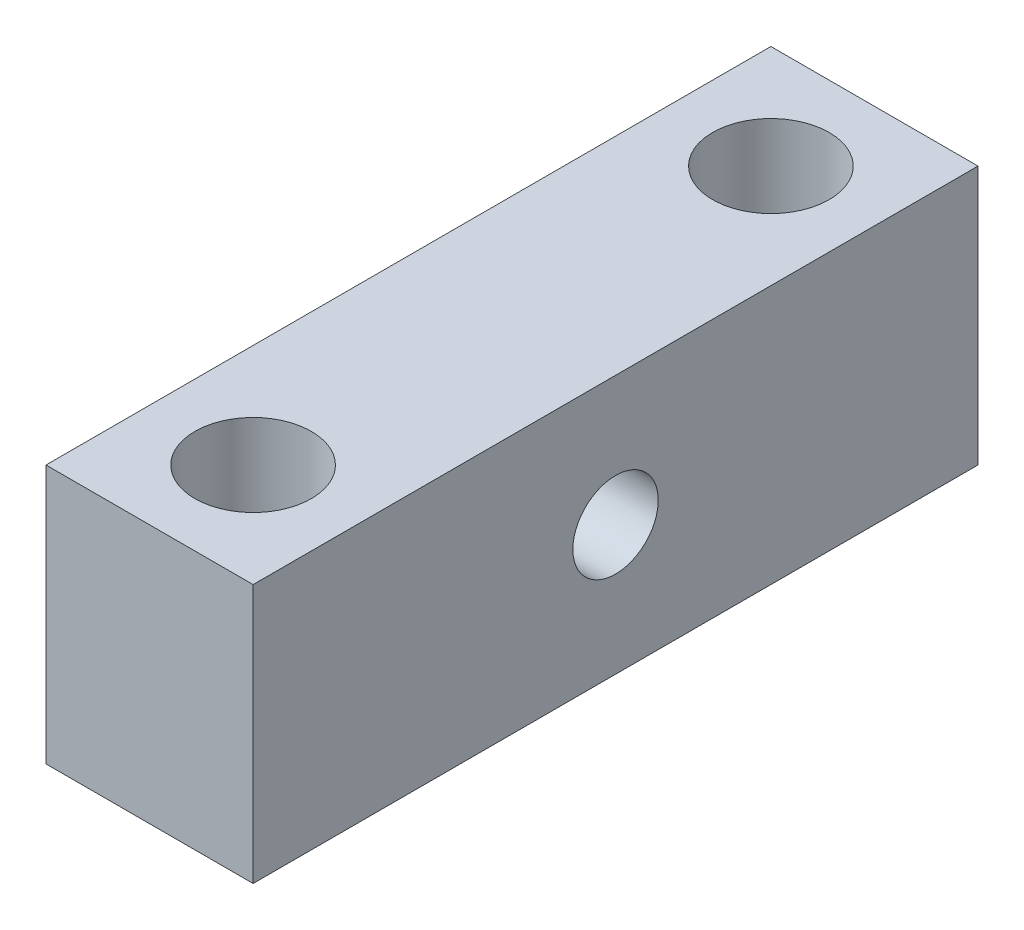
from build123d import *

# Parameters (mm, degrees)
ESQUISSE1_W                  = 8
ESQUISSE1_H                  = 10
BOSS_EXTRU_1_DEPTH           = 28
ESQUISSE2_R                  = 2.25
ENL_V_MAT_EXTRU_1_DEPTH      = 31.789608637
ENL_V_MAT_EXTRU_2_DEPTH      = 31.789608637
ENL_V_MAT_EXTRU_2_DEPTH_BACK = 31.789608637
ESQUISSE3_R                  = 1.65


with BuildPart() as part:
    # Esquisse1 → Boss.-Extru.1 (new body)
    with BuildSketch(Plane.XY):
        with Locations((4, 5)):
            Rectangle(ESQUISSE1_W, ESQUISSE1_H)
    extrude(amount=BOSS_EXTRU_1_DEPTH)

    # Esquisse2 → Enlèv. mat.-Extru.1 (cut, through all)
    with BuildSketch(Plane(origin=(0, 10, 0), x_dir=(1, 0, 0), z_dir=(0, 1, 0))):
        with Locations((4, -24)):
            Circle(ESQUISSE2_R)
        with Locations((4, -4)):
            Circle(ESQUISSE2_R)
    extrude(amount=-ENL_V_MAT_EXTRU_1_DEPTH, mode=Mode.SUBTRACT)

    # Esquisse3 → Enlèv. mat.-Extru.2 (cut, two sides: drawn at the far end of the back side and taken through both)
    with BuildSketch(Plane.ZY.offset(-ENL_V_MAT_EXTRU_2_DEPTH_BACK)):
        with Locations((14, 5)):
            Circle(ESQUISSE3_R)
    extrude(amount=ENL_V_MAT_EXTRU_2_DEPTH + ENL_V_MAT_EXTRU_2_DEPTH_BACK, mode=Mode.SUBTRACT)


solid = part.part
